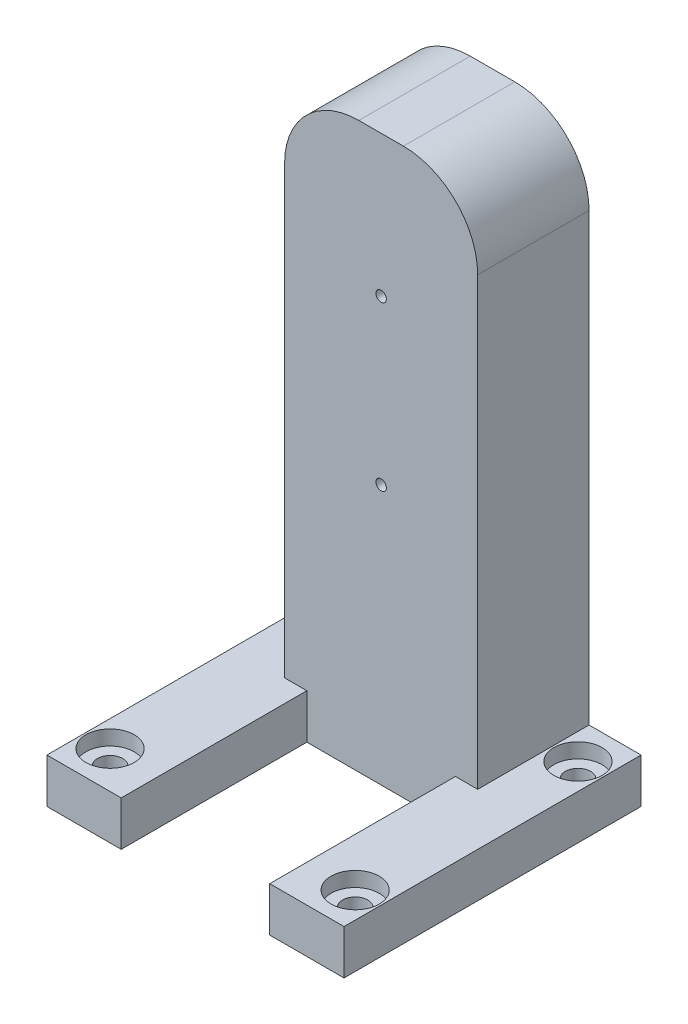
from build123d import *

# Parameters (mm, degrees)
BOSS_EXTRU_1_DEPTH                                   = 15
ESQUISSE2_W                                          = 10
ESQUISSE2_H                                          = 25
BOSS_EXTRU_2_DEPTH                                   = 6
D_GAGEMENT_M1_21_D                                   = 1.4
CHAMBRAGE_POUR_T_TE_CYLINDRIQUE_FENDUE_M_D           = 3.4
CHAMBRAGE_POUR_T_TE_CYLINDRIQUE_FENDUE_M_CBORE_D     = 6.5
CHAMBRAGE_POUR_T_TE_CYLINDRIQUE_FENDUE_M_CBORE_DEPTH = 2
CONG_1_R                                             = 10


with BuildPart() as part:
    # Esquisse1 → Boss.-Extru.1 (new body)
    with BuildSketch(Plane.XY):
        Polygon((0, 0), (-20, 0), (-20, 6), (-13, 6), (-13, 76), (13, 76), (13, 6), (20, 6), (20, 0), align=None)
    extrude(amount=BOSS_EXTRU_1_DEPTH)

    # Esquisse2 → Boss.-Extru.2 (add)
    with BuildSketch(Plane.XZ):
        with Locations((-15, 27.5)):
            Rectangle(ESQUISSE2_W, ESQUISSE2_H)
        with Locations((15, 27.5)):
            Rectangle(ESQUISSE2_W, ESQUISSE2_H)
    extrude(amount=-BOSS_EXTRU_2_DEPTH)

    # Dégagement M1.21 (through all)
    with Locations(Plane.XY.offset(15)):
        with Locations((0, 57), (0, 35)):
            Hole(D_GAGEMENT_M1_21_D / 2)

    # Chambrage pour tête cylindrique fendue M31 (through all)
    with Locations(Plane(origin=(0, 6, 0), x_dir=(1, 0, 0), z_dir=(0, 1, 0))):
        with Locations((-16.5, -5), (16.5, -5), (16.5, -35), (-16.5, -35)):
            CounterBoreHole(CHAMBRAGE_POUR_T_TE_CYLINDRIQUE_FENDUE_M_D / 2, CHAMBRAGE_POUR_T_TE_CYLINDRIQUE_FENDUE_M_CBORE_D / 2, CHAMBRAGE_POUR_T_TE_CYLINDRIQUE_FENDUE_M_CBORE_DEPTH)

    # Congé1
    cong_1_edges = [part.edges().sort_by_distance(p)[0] for p in [
        (13, 76, 7.5),
        (-13, 76, 7.5),
    ]]
    fillet(cong_1_edges, radius=CONG_1_R)


solid = part.part
